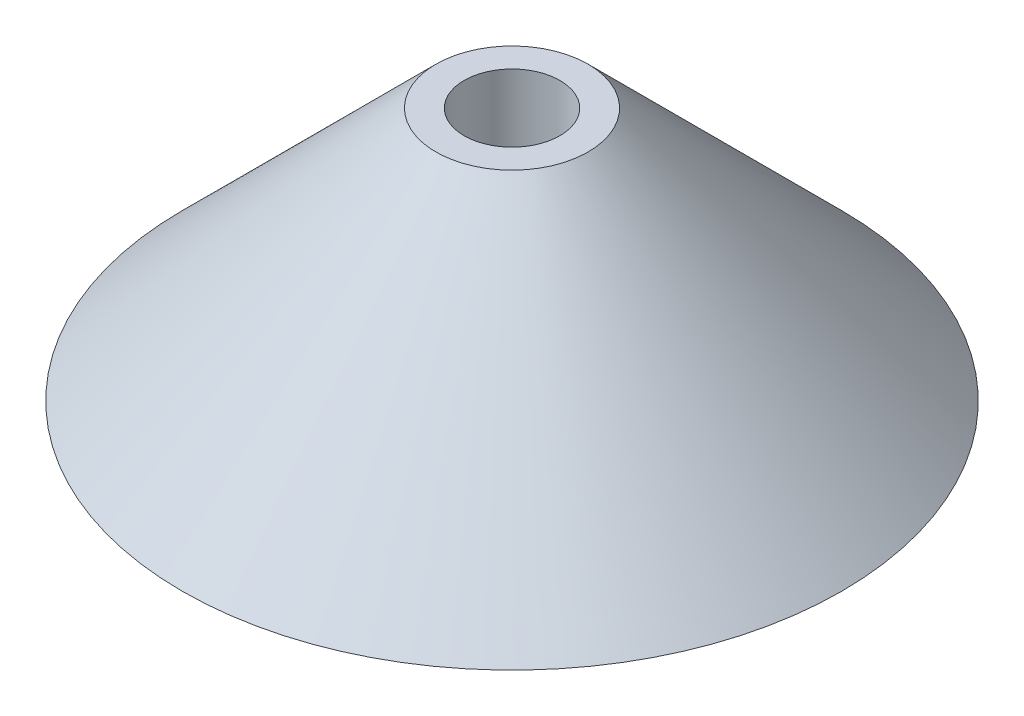
from build123d import *


with BuildPart() as part:
    # Sketch1 → Revolve1 (revolve)
    with BuildSketch(Plane.XY):
        Polygon((-2.7, 9), (-11.7, 0), (-1.7, 0), (-1.7, 9), align=None)
    revolve(axis=Axis((0, 11.326530612, 0), (0, -1, 0)))


solid = part.part
